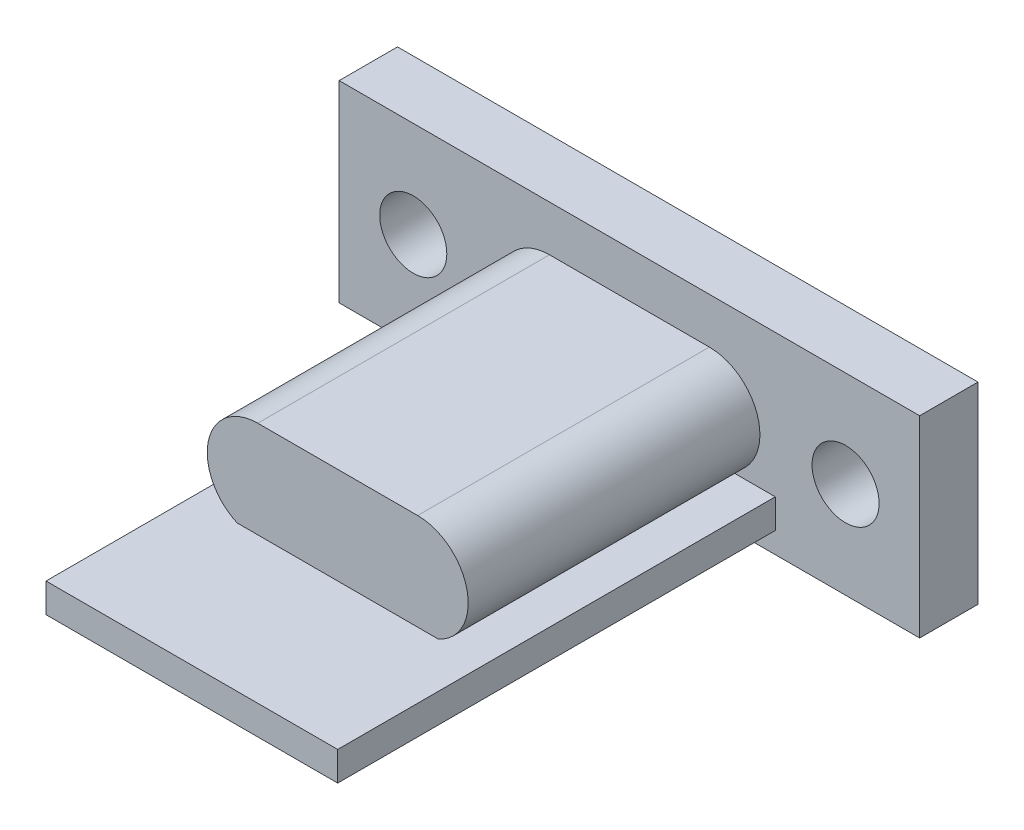
from build123d import *

# Parameters (mm, degrees)
SKETCH1_W            = 19.9
SKETCH1_H            = 6.6
SKETCH1_R            = 1.15
BOSS_EXTRUDE1_DEPTH  = 2
BOSS_EXTRUDE11_DEPTH = 10
BOSS_EXTRUDE12_START = -1
BOSS_EXTRUDE12_DEPTH = 1
SKETCH8_W            = 10
SKETCH8_H            = 1
BOSS_EXTRUDE13_DEPTH = 5


with BuildPart() as part:
    # Sketch1 → Boss-Extrude1 (new body)
    with BuildSketch(Plane.XY):
        with Locations((9.95, 3.3)):
            Rectangle(SKETCH1_W, SKETCH1_H)
        with Locations((2.54, 3.3)):
            Circle(SKETCH1_R, mode=Mode.SUBTRACT)
        with Locations((17.36, 3.3)):
            Circle(SKETCH1_R, mode=Mode.SUBTRACT)
        with BuildLine():
            Line((7.21, 4.88), (12.69, 4.88))
            ThreePointArc((12.69, 4.88), (14.27, 3.3), (12.69, 1.72))
            Line((12.69, 1.72), (7.21, 1.72))
            ThreePointArc((7.21, 1.72), (5.63, 3.3), (7.21, 4.88))
        make_face(mode=Mode.SUBTRACT)
    extrude(amount=BOSS_EXTRUDE1_DEPTH)

    # Sketch6 → Boss-Extrude11 (add)
    with BuildSketch(Plane.XY.offset(2)):
        with BuildLine():
            Line((7.21, 5.033060679), (12.69, 5.033060679))
            ThreePointArc((12.69, 5.033060679), (14.384837637, 3.661973344), (13.397979882, 1.718145455))
            Line((13.397979882, 1.718145455), (14.95, 1.718145455))
            Line((14.95, 1.718145455), (14.95, 0.718145455))
            Line((14.95, 0.718145455), (4.95, 0.718145455))
            Line((4.95, 0.718145455), (4.95, 1.718145455))
            Line((4.95, 1.718145455), (6.502020118, 1.718145455))
            ThreePointArc((6.502020118, 1.718145455), (5.515162363, 3.661973344), (7.21, 5.033060679))
        make_face()
        with BuildLine():
            Line((7.21, 4.57), (12.69, 4.57))
            ThreePointArc((12.69, 4.57), (13.96, 3.3), (12.69, 2.03))
            Line((12.69, 2.03), (7.21, 2.03))
            ThreePointArc((7.21, 2.03), (5.94, 3.3), (7.21, 4.57))
        make_face(mode=Mode.SUBTRACT)
    extrude(amount=BOSS_EXTRUDE11_DEPTH)

    # Sketch7 → Boss-Extrude12 (add)
    with BuildSketch(Plane.XY.offset(12).offset(BOSS_EXTRUDE12_START)):
        with BuildLine():
            Line((7.21, 5.033060679), (12.69, 5.033060679))
            ThreePointArc((12.69, 5.033060679), (14.423060679, 3.3), (12.69, 1.566939321))
            Line((12.69, 1.566939321), (7.21, 1.566939321))
            ThreePointArc((7.21, 1.566939321), (5.476939321, 3.3), (7.21, 5.033060679))
        make_face()
    extrude(amount=BOSS_EXTRUDE12_DEPTH)

    # Sketch8 → Boss-Extrude13 (add)
    with BuildSketch(Plane.XY.offset(12)):
        with Locations((9.95, 1.218145455)):
            Rectangle(SKETCH8_W, SKETCH8_H)
    extrude(amount=BOSS_EXTRUDE13_DEPTH)


solid = part.part
